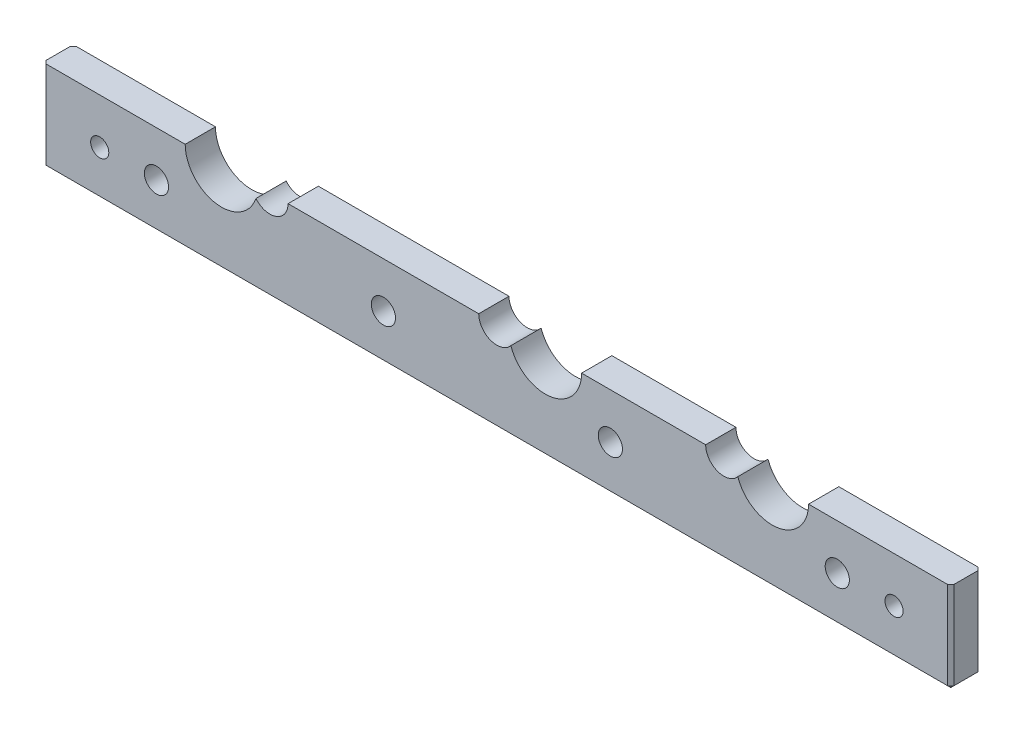
from build123d import *

# Parameters (mm, degrees)
SKETCH1_W                      = 150
SKETCH1_H                      = 30
BOSS_EXTRUDE1_DEPTH            = 5
F_6_0MM_DOWEL_HOLE1_AT_2_COUNT = 2
F_6_0MM_DOWEL_HOLE1_AT_2_PITCH = 37.5
F_4_0MM_DOWEL_HOLE1_AT_2_COUNT = 2
F_4_0MM_DOWEL_HOLE1_AT_2_PITCH = 37.5
CHAMFER1_SIZE                  = 0.5
SKETCH21_W                     = 150
SKETCH21_H                     = 15
CUT_EXTRUDE1_DEPTH             = 10
F_12_0MM_DOWEL_HOLE2_D         = 12
F_12_0MM_DOWEL_HOLE2_DEPTH     = 25
F_12_0MM_DOWEL_HOLE2_TIP       = 3.605163714


with BuildPart() as part:
    # Sketch1 → Boss-Extrude1 (new body)
    with BuildSketch(Plane.XY):
        with Locations((18.189254194, 3.553058878)):
            Rectangle(SKETCH1_W, SKETCH1_H)
    extrude(amount=BOSS_EXTRUDE1_DEPTH)

    # Sketch4 → Ø6.0mm Dowel Hole1 (revolve, cut)
    with BuildSketch(Plane(origin=(55.689254194, 3.553058878, 5), x_dir=(0, -1, 0), z_dir=(1, 0, 0))):
        Polygon((0, 0), (0, 26.802581857), (3, 25), (3, 0), align=None)
    f_6_0mm_dowel_hole1 = revolve(axis=Axis((55.689254194, 3.553058878, 11.35), (0, 0, -1)), mode=Mode.SUBTRACT)

    # Ø6.0mm Dowel Hole1 at 2: Ø6.0mm Dowel Hole1 ×2
    with Locations(*[(-i * F_6_0MM_DOWEL_HOLE1_AT_2_PITCH, 0, 0) for i in range(1, F_6_0MM_DOWEL_HOLE1_AT_2_COUNT)]):
        add(f_6_0mm_dowel_hole1, mode=Mode.SUBTRACT)

    # Mirror1: Ø6.0mm Dowel Hole1 across plane
    add(f_6_0mm_dowel_hole1.mirror(Plane.ZY.offset(-18.189254194)), mode=Mode.SUBTRACT)

    # Mirror1 copy 1 sketch → Mirror1 copy 1 (revolve, cut)
    with BuildSketch(Plane(origin=(18.189254194, 3.553058878, 5), x_dir=(0, -1, 0), z_dir=(-1, 0, 0))):
        Polygon((0, 0), (0, -26.802581857), (3, -25), (3, 0), align=None)
    revolve(axis=Axis((18.189254194, 3.553058878, 11.35), (0, 0, 1)), mode=Mode.SUBTRACT)

    # Sketch6 → Ø4.0mm Dowel Hole1 (revolve, cut)
    with BuildSketch(Plane(origin=(74.439254194, 11.053058878, 5), x_dir=(0, -1, 0), z_dir=(1, 0, 0))):
        Polygon((0, 0), (0, 26.201721238), (2, 25), (2, 0), align=None)
    f_4_0mm_dowel_hole1 = revolve(axis=Axis((74.439254194, 11.053058878, 11.35), (0, 0, -1)), mode=Mode.SUBTRACT)

    # Ø4.0mm Dowel Hole1 at 2: Ø4.0mm Dowel Hole1 ×2
    with Locations(*[(-i * F_4_0MM_DOWEL_HOLE1_AT_2_PITCH, 0, 0) for i in range(1, F_4_0MM_DOWEL_HOLE1_AT_2_COUNT)]):
        add(f_4_0mm_dowel_hole1, mode=Mode.SUBTRACT)

    # Mirror2: Ø4.0mm Dowel Hole1 across plane
    add(f_4_0mm_dowel_hole1.mirror(Plane.ZX.offset(3.553058878)), mode=Mode.SUBTRACT)

    # Mirror2 copy 1 sketch → Mirror2 copy 1 (revolve, cut)
    with BuildSketch(Plane(origin=(36.939254194, -3.946941122, 5), x_dir=(0, 1, 0), z_dir=(1, 0, 0))):
        Polygon((0, 0), (0, -26.201721238), (2, -25), (2, 0), align=None)
    revolve(axis=Axis((36.939254194, -3.946941122, 11.35), (0, 0, 1)), mode=Mode.SUBTRACT)

    # Mirror3 copy 1 sketch → Mirror3 copy 1 (revolve, cut)
    with BuildSketch(Plane(origin=(-38.060745806, -3.946941122, 5), x_dir=(0, 1, 0), z_dir=(-1, 0, 0))):
        Polygon((0, 0), (0, 26.201721238), (2, 25), (2, 0), align=None)
    revolve(axis=Axis((-38.060745806, -3.946941122, 11.35), (0, 0, -1)), mode=Mode.SUBTRACT)

    # Mirror3 copy 2 sketch → Mirror3 copy 2 (revolve, cut)
    with BuildSketch(Plane(origin=(-0.560745806, -3.946941122, 5), x_dir=(0, 1, 0), z_dir=(-1, 0, 0))):
        Polygon((0, 0), (0, 26.201721238), (2, 25), (2, 0), align=None)
    revolve(axis=Axis((-0.560745806, -3.946941122, 11.35), (0, 0, -1)), mode=Mode.SUBTRACT)

    # Mirror3 copy 3 sketch → Mirror3 copy 3 (revolve, cut)
    with BuildSketch(Plane(origin=(-38.060745806, 11.053058878, 5), x_dir=(0, -1, 0), z_dir=(-1, 0, 0))):
        Polygon((0, 0), (0, -26.201721238), (2, -25), (2, 0), align=None)
    revolve(axis=Axis((-38.060745806, 11.053058878, 11.35), (0, 0, 1)), mode=Mode.SUBTRACT)

    # Mirror3 copy 4 sketch → Mirror3 copy 4 (revolve, cut)
    with BuildSketch(Plane(origin=(-0.560745806, 11.053058878, 5), x_dir=(0, -1, 0), z_dir=(-1, 0, 0))):
        Polygon((0, 0), (0, -26.201721238), (2, -25), (2, 0), align=None)
    revolve(axis=Axis((-0.560745806, 11.053058878, 11.35), (0, 0, 1)), mode=Mode.SUBTRACT)

    # Chamfer1
    chamfer1_edges = [part.edges().sort_by_distance(p)[0] for p in [
        (-56.810745806, 18.553058878, 2.5),
        (-56.810745806, 3.553058878, 5),
        (-56.810745806, -11.446941122, 2.5),
        (-56.810745806, 3.553058878, 0),
        (18.189254194, -11.446941122, 5),
        (18.189254194, -11.446941122, 0),
        (18.189254194, 18.553058878, 5),
        (93.189254194, 3.553058878, 5),
        (93.189254194, -11.446941122, 2.5),
        (93.189254194, 3.553058878, 0),
        (18.189254194, 18.553058878, 0),
    ]]
    chamfer(chamfer1_edges, length=CHAMFER1_SIZE)

    # Sketch21 → Cut-Extrude1 (cut)
    with BuildSketch(Plane.XY.offset(5)):
        with Locations((18.189254194, 11.053058878)):
            Rectangle(SKETCH21_W, SKETCH21_H)
    extrude(amount=-CUT_EXTRUDE1_DEPTH, mode=Mode.SUBTRACT)

    # Sketch23 → Ø3.0mm Dowel Hole2 (revolve, cut)
    with BuildSketch(Plane(origin=(-47.435745806, -3.946941122, 5), x_dir=(0, -1, 0), z_dir=(1, 0, 0))):
        Polygon((0, 0), (0, 25.901290929), (1.5, 25), (1.5, 0), align=None)
    f_3_0mm_dowel_hole2 = revolve(axis=Axis((-47.435745806, -3.946941122, 11.35), (0, 0, -1)), mode=Mode.SUBTRACT)

    # Mirror5: Ø3.0mm Dowel Hole2 across plane
    add(f_3_0mm_dowel_hole2.mirror(Plane.ZY.offset(-18.189254194)), mode=Mode.SUBTRACT)

    # Sketch26 → Ø12.0mm Dowel Hole1 (revolve, cut)
    with BuildSketch(Plane(origin=(63.689254194, 3.553058878, 5), x_dir=(0, -1, 0), z_dir=(1, 0, 0))):
        Polygon((0, 0), (0, 28.605163714), (6, 25), (6, 0), align=None)
    f_12_0mm_dowel_hole1 = revolve(axis=Axis((63.689254194, 3.553058878, 11.35), (0, 0, -1)), mode=Mode.SUBTRACT)

    # Mirror6: Ø12.0mm Dowel Hole1 across plane
    add(f_12_0mm_dowel_hole1.mirror(Plane.ZY.offset(-18.189254194)), mode=Mode.SUBTRACT)

    # Ø12.0mm Dowel Hole2
    with Locations(Plane(origin=(26.189254194, 3.553058878, 5), x_dir=(1, 0, 0), z_dir=(0, 0, 1))):
        with Locations((0, 0)):
            Hole(F_12_0MM_DOWEL_HOLE2_D / 2, depth=F_12_0MM_DOWEL_HOLE2_DEPTH)
            with Locations((0, 0, -(F_12_0MM_DOWEL_HOLE2_DEPTH + F_12_0MM_DOWEL_HOLE2_TIP / 2))):  # 118° drill point
                Cone(0, F_12_0MM_DOWEL_HOLE2_D / 2, F_12_0MM_DOWEL_HOLE2_TIP, mode=Mode.SUBTRACT)


solid = part.part
